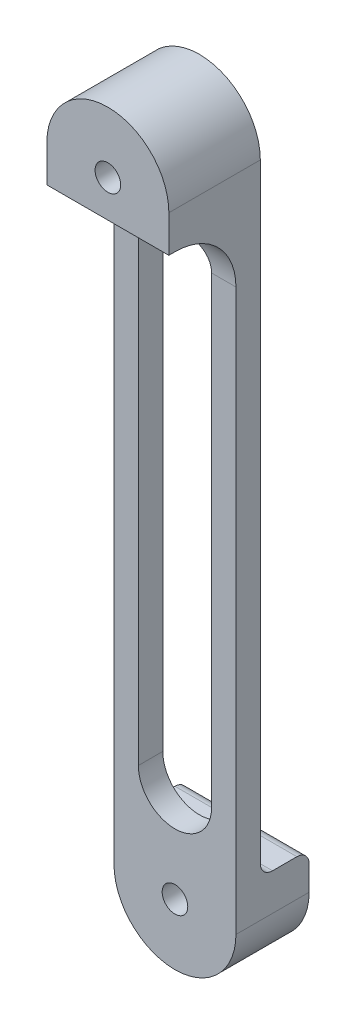
from build123d import *

# Parameters (mm, degrees)
CROQUIS1_R              = 2.1
SALIENTE_EXTRUIR1_DEPTH = 4
SALIENTE_EXTRUIR2_START = -8
CROQUIS1_5_R            = 2.1
SALIENTE_EXTRUIR2_DEPTH = 8
REDONDEO2_R             = 2
CROQUIS1_6_R            = 2.1
SALIENTE_EXTRUIR3_DEPTH = 15
REDONDEO1_R             = 10


with BuildPart() as part:
    # Croquis1 → Saliente-Extruir1 (new body)
    with BuildSketch(Plane.XY):
        with BuildLine():
            Line((10, 54), (10, -54))
            ThreePointArc((10, -54), (0, -64), (-10, -54))
            Line((-10, -54), (-10, 54))
            ThreePointArc((-10, 54), (0, 64), (10, 54))
        make_face()
        with Locations((0, 54)):
            Circle(CROQUIS1_R, mode=Mode.SUBTRACT)
        with Locations((0, -54)):
            Circle(CROQUIS1_R, mode=Mode.SUBTRACT)
        with BuildLine():
            Line((6, 38), (6, -38))
            ThreePointArc((6, -38), (0, -44), (-6, -38))
            Line((-6, -38), (-6, 38))
            ThreePointArc((-6, 38), (0, 44), (6, 38))
        make_face(mode=Mode.SUBTRACT)
    extrude(amount=SALIENTE_EXTRUIR1_DEPTH)

    # Croquis1<5> → Saliente-Extruir2 (add)
    with BuildSketch(Plane.XY.offset(SALIENTE_EXTRUIR2_START)):
        with BuildLine():
            Line((10, -54), (10, -47.95))
            Line((10, -47.95), (-10, -47.95))
            Line((-10, -47.95), (-10, -54))
            ThreePointArc((-10, -54), (0, -64), (10, -54))
        make_face()
        with Locations((0, -54)):
            Circle(CROQUIS1_5_R, mode=Mode.SUBTRACT)
    extrude(amount=SALIENTE_EXTRUIR2_DEPTH)

    # Redondeo2
    redondeo2_edges = [part.edges().sort_by_distance(p)[0] for p in [
        (0, -47.95, 0),
        (0, -47.95, -8),
    ]]
    fillet(redondeo2_edges, radius=REDONDEO2_R)

    # Croquis1<6> → Saliente-Extruir3 (add)
    with BuildSketch(Plane.XY):
        with BuildLine():
            Line((10, 47.95), (10, 54))
            ThreePointArc((10, 54), (0, 64), (-10, 54))
            Line((-10, 54), (-10, 47.95))
            Line((-10, 47.95), (10, 47.95))
        make_face()
        with Locations((0, 54)):
            Circle(CROQUIS1_6_R, mode=Mode.SUBTRACT)
    extrude(amount=SALIENTE_EXTRUIR3_DEPTH)

    # Redondeo1
    # the kernel refuses this fillet: 10 mm, written as the material it adds along each edge
    with BuildSketch(Plane(origin=(-10, 47.95, 4), x_dir=(0, 0, 1), z_dir=(1, 0, 0))) as redondeo1_piece_1_section:
        with BuildLine():
            CenterArc((REDONDEO1_R, REDONDEO1_R), REDONDEO1_R, 180, 90)
            Line((0, REDONDEO1_R), (0, 0))
            Line((0, 0), (REDONDEO1_R, 0))
        make_face()
    redondeo1_piece_1 = extrude(amount=20, mode=Mode.PRIVATE)
    redondeo1_piece_1 = redondeo1_piece_1 - Plane(origin=(0, 38, 6.263951143), x_dir=(-1, 0, 0), z_dir=(0, 0, -1)) * Cylinder(6, 80, mode=Mode.PRIVATE)
    add(redondeo1_piece_1)


solid = part.part
